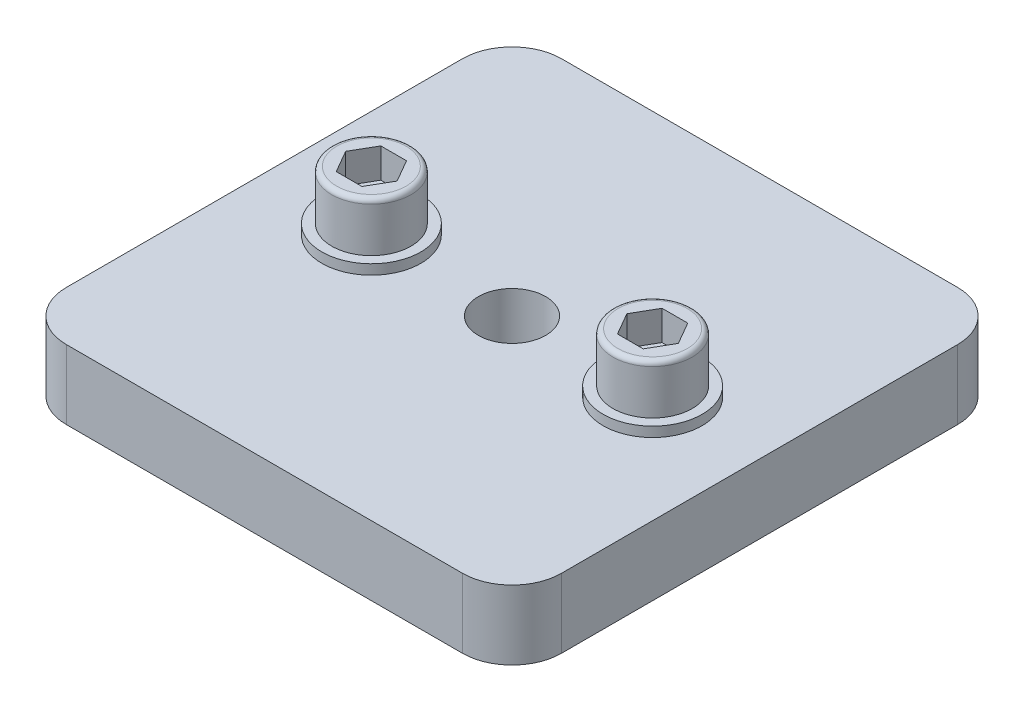
from build123d import *

# Parameters (mm, degrees)
SKETCH1_R                = 3.4
BOSS_EXTRUDE1_DEPTH      = 7
SKETCH4_R                = 5
BOSS_EXTRUDE2_DEPTH      = 1
SKETCH5_R                = 4
BOSS_EXTRUDE3_DEPTH      = 5
CUT_EXTRUDE1_DEPTH       = 3
FILLET1_R                = 0.5
CIRPATTERN1_COUNT        = 2
CIRPATTERN1_ANGLE        = 90
FILLET1_OF_CIRPATTERN1_R = 0.5
SKETCH7_W                = 13.377916116
SKETCH7_H                = 10.003544581
SKETCH7_W_2              = 13.109283262
SKETCH7_H_2              = 10.863169713
CUT_EXTRUDE2_DEPTH       = 58.393379409


# Read off the part's stored shape, not the designer's step: Imported1
with BuildPart() as part:
    # Sketch1 → Boss-Extrude1 (new body)
    with BuildSketch(Plane(origin=(0, 7, 0), x_dir=(1, 0, 0), z_dir=(0, 1, 0))):
        with BuildLine():
            Line((-25, 20), (-25, -20))
            ThreePointArc((-25, -20), (-23.535533906, -23.535533906), (-20, -25))
            Line((-20, -25), (20, -25))
            ThreePointArc((20, -25), (23.535533906, -23.535533906), (25, -20))
            Line((25, -20), (25, 20))
            ThreePointArc((25, 20), (23.535533906, 23.535533906), (20, 25))
            Line((20, 25), (-20, 25))
            ThreePointArc((-20, 25), (-23.535533906, 23.535533906), (-25, 20))
        make_face()
        with Locations(Location((0, 0, 0), (0, 0, 270))):
            Circle(SKETCH1_R, mode=Mode.SUBTRACT)
    extrude(amount=-BOSS_EXTRUDE1_DEPTH)

    # Sketch4 → Boss-Extrude2 (add)
    with BuildSketch(Plane(origin=(0, 7, 0), x_dir=(1, 0, 0), z_dir=(0, 1, 0))):
        with Locations(Location((0, 14.2, 0), (0, 0, 270))):
            Circle(SKETCH4_R)
        with Locations(Location((0, -14.2, 0), (0, 0, 270))):
            Circle(SKETCH4_R)
    boss_extrude2 = extrude(amount=BOSS_EXTRUDE2_DEPTH)

    # Sketch5 → Boss-Extrude3 (add)
    with BuildSketch(Plane(origin=(0, 8, 0), x_dir=(1, 0, 0), z_dir=(0, 1, 0))):
        with Locations(Location((0, 14.2, 0), (0, 0, 270))):
            Circle(SKETCH5_R)
        with Locations(Location((0, -14.2, 0), (0, 0, 270))):
            Circle(SKETCH5_R)
    boss_extrude3 = extrude(amount=BOSS_EXTRUDE3_DEPTH)

    # Sketch6 → Cut-Extrude1 (cut)
    with BuildSketch(Plane(origin=(0, 13, 0), x_dir=(1, 0, 0), z_dir=(0, 1, 0))):
        Polygon((0, 16.798076211), (-2.25, 15.499038106), (-2.25, 12.900961894), (0, 11.601923789), (2.25, 12.900961894), (2.25, 15.499038106), align=None)
        Polygon((0, -11.601923789), (-2.25, -12.900961894), (-2.25, -15.499038106), (0, -16.798076211), (2.25, -15.499038106), (2.25, -12.900961894), align=None)
    cut_extrude1 = extrude(amount=-CUT_EXTRUDE1_DEPTH, mode=Mode.SUBTRACT)

    # Fillet1
    fillet1_edges = [part.edges().sort_by_distance(p)[0] for p in [
        (0, 13, -18.2),
        (0, 13, 10.2),
    ]]
    fillet(fillet1_edges, radius=FILLET1_R)

    # CirPattern1: Boss-Extrude2, Boss-Extrude3, Cut-Extrude1 ×2 about axis
    cirpattern1_axis = Axis((0, 0, 0), (0, -1, 0))
    add([boss_extrude2.rotate(cirpattern1_axis, i * CIRPATTERN1_ANGLE / (CIRPATTERN1_COUNT - 1)) for i in range(1, CIRPATTERN1_COUNT)])
    add([boss_extrude3.rotate(cirpattern1_axis, i * CIRPATTERN1_ANGLE / (CIRPATTERN1_COUNT - 1)) for i in range(1, CIRPATTERN1_COUNT)])
    add([cut_extrude1.rotate(cirpattern1_axis, i * CIRPATTERN1_ANGLE / (CIRPATTERN1_COUNT - 1)) for i in range(1, CIRPATTERN1_COUNT)], mode=Mode.SUBTRACT)

    # Fillet1 of CirPattern1
    fillet1_of_cirpattern1_edges = [part.edges().sort_by_distance(p)[0] for p in [
        (18.2, 13, 0),
        (-10.2, 13, 0),
    ]]
    fillet(fillet1_of_cirpattern1_edges, radius=FILLET1_OF_CIRPATTERN1_R)

    # Sketch7 → Cut-Extrude2 (cut, through all)
    with BuildSketch(Plane(origin=(25, 0, 0), x_dir=(0, 0, -1), z_dir=(1, 0, 0))):
        with Locations((14.04949825, 12.00177229)):
            Rectangle(SKETCH7_W, SKETCH7_H)
        with Locations((-13.592822399, 12.431584857)):
            Rectangle(SKETCH7_W_2, SKETCH7_H_2)
    extrude(amount=-CUT_EXTRUDE2_DEPTH, mode=Mode.SUBTRACT)


solid = part.part
